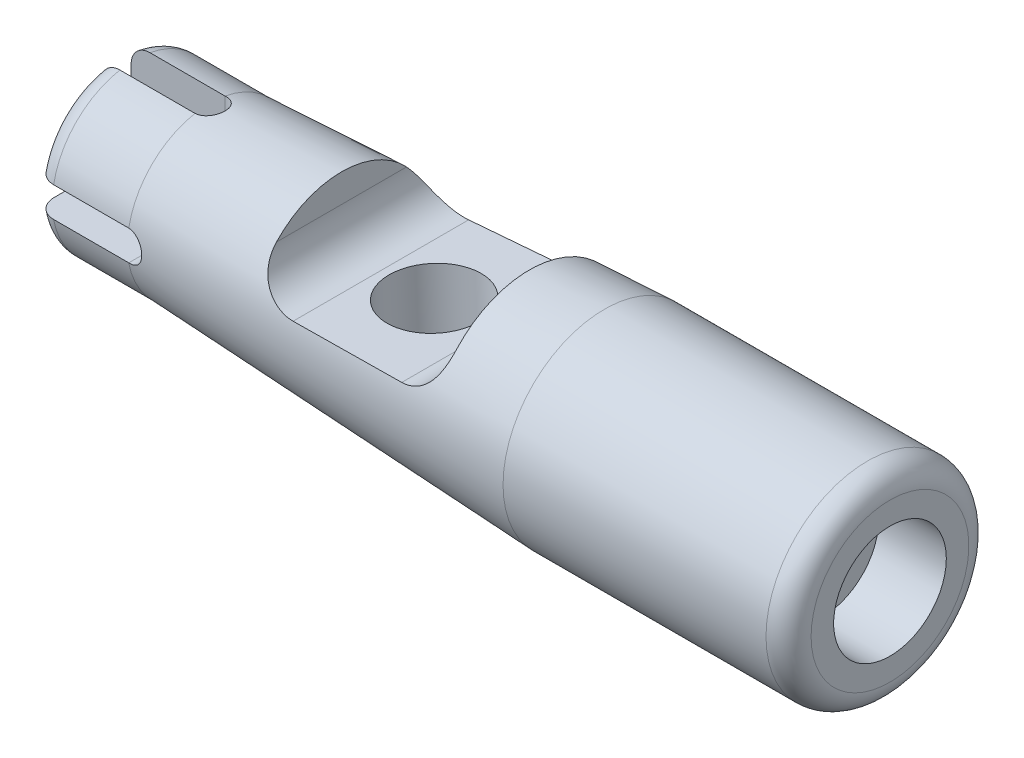
from build123d import *

# Parameters (mm, degrees)
CUT_EXTRUDE1_DEPTH      = 117.039737999
CUT_EXTRUDE2_DEPTH      = 117.039738117
CUT_EXTRUDE2_DEPTH_BACK = 117.039738117
CUT_EXTRUDE3_DEPTH      = 117.039738117
CUT_EXTRUDE3_DEPTH_BACK = 117.039738117
SKETCH4_W               = 57.142016454
SKETCH4_H               = 5
SKETCH5_R               = 3
CUT_EXTRUDE4_DEPTH      = 12
SKETCH6_R               = 15
CUT_EXTRUDE5_DEPTH      = 18
SKETCH6_3_R             = 7.5
CUT_EXTRUDE6_DEPTH      = 38
SKETCH7_R               = 12
CUT_EXTRUDE7_DEPTH      = 16
CIRPATTERN1_COUNT       = 4
FILLET2_R               = 5


with BuildPart() as part:
    # Sketch1 → Revolve1 (revolve)
    with BuildSketch(Plane.XY, mode=Mode.PRIVATE) as revolve1_sk:
        with BuildLine():
            Line((90.422535211, 27), (20.422535211, 27))
            Line((20.422535211, 27), (-84.577464789, 22))
            Line((-84.577464789, 22), (-104.577464789, 22))
            ThreePointArc((-104.577464789, 22), (-108.112998695, 20.535533906), (-109.577464789, 17))
            Line((-109.577464789, 17), (-109.577464789, 0))
            Line((-109.577464789, 0), (96.422535211, 0))
            Line((96.422535211, 0), (96.422535211, 21))
            ThreePointArc((96.422535211, 21), (94.665175898, 25.242640687), (90.422535211, 27))
        make_face()
    revolve(revolve1_sk.sketch.rotate(Axis((-109.577464789, 0, 0), (1, 0, 0)), 90), axis=Axis((-109.577464789, 0, 0), (1, 0, 0)))

    # Sketch2 → Cut-Extrude1 (cut, symmetric)
    with BuildSketch(Plane.XY):
        with BuildLine():
            Line((-123.826972542, 4), (-84.577464789, 4))
            ThreePointArc((-84.577464789, 4), (-80.577464789, 0), (-84.577464789, -4))
            Line((-84.577464789, -4), (-123.826972542, -4))
            ThreePointArc((-123.826972542, -4), (-127.826972542, 0), (-123.826972542, 4))
        make_face()
    cut_extrude1 = extrude(amount=CUT_EXTRUDE1_DEPTH, both=True, mode=Mode.SUBTRACT)

    # Sketch3 → Cut-Extrude2 (cut, two sides: drawn at the far end of the back side and taken through both)
    with BuildSketch(Plane.XY.offset(-CUT_EXTRUDE2_DEPTH_BACK)):
        with BuildLine():
            Line((0.422535211, 26.047619048), (0.422535211, 17.562363413))
            ThreePointArc((0.422535211, 17.562363413), (-2.340182324, 10.661512557), (-9.101813295, 7.573682035))
            Line((-9.101813295, 7.573682035), (-39.101813295, 6.145110607))
            ThreePointArc((-39.101813295, 6.145110607), (-46.478315644, 8.89650952), (-49.577464789, 16.133791984))
            Line((-49.577464789, 16.133791984), (-49.577464789, 23.666666667))
            Line((-49.577464789, 23.666666667), (0.422535211, 26.047619048))
        make_face()
    extrude(amount=CUT_EXTRUDE2_DEPTH + CUT_EXTRUDE2_DEPTH_BACK, mode=Mode.SUBTRACT)

    # Sketch4 → Cut-Extrude3 (cut, two sides: drawn at the far end of the back side and taken through both)
    with BuildSketch(Plane.XY.offset(-CUT_EXTRUDE3_DEPTH_BACK)):
        with Locations((48.993543438, -24.5)):
            Rectangle(SKETCH4_W, SKETCH4_H)
    extrude(amount=CUT_EXTRUDE3_DEPTH + CUT_EXTRUDE3_DEPTH_BACK, mode=Mode.SUBTRACT)

    # Sketch5 → Cut-Extrude4 (cut)
    with BuildSketch(Plane.XZ.offset(22)):
        with Locations(Location((45.127981308, 12, 0), (0, 0, 270))):
            Circle(SKETCH5_R)
        with Locations(Location((45.127981308, -12, 0), (0, 0, 270))):
            Circle(SKETCH5_R)
    extrude(amount=-CUT_EXTRUDE4_DEPTH, mode=Mode.SUBTRACT)

    # Sketch6 → Cut-Extrude5 (cut)
    with BuildSketch(Plane(origin=(96.422535211, 0, 0), x_dir=(0, 0, -1), z_dir=(1, 0, 0))):
        Circle(SKETCH6_R)
    extrude(amount=-CUT_EXTRUDE5_DEPTH, mode=Mode.SUBTRACT)

    # Sketch6<3> → Cut-Extrude6 (cut)
    with BuildSketch(Plane(origin=(96.422535211, 0, 0), x_dir=(0, 0, -1), z_dir=(1, 0, 0))):
        Circle(SKETCH6_3_R)
    extrude(amount=-CUT_EXTRUDE6_DEPTH, mode=Mode.SUBTRACT)

    # Sketch7 → Cut-Extrude7 (cut)
    with BuildSketch(Plane(origin=(-0.38042791, 7.988986101, 0), x_dir=(0.9988681377244376, 0.047565149415449294, 0), z_dir=(-0.0475651494154493, 0.9988681377244377, 0))):
        with Locations(Location((-24.57794304, 0, 0), (0, 0, 180))):
            Circle(SKETCH7_R)
    extrude(amount=-CUT_EXTRUDE7_DEPTH, mode=Mode.SUBTRACT)

    # CirPattern1: Cut-Extrude1 ×4 about axis
    cirpattern1_axis = Axis((-109.577464789, 0, 0), (-1, 0, 0))
    for i in range(1, CIRPATTERN1_COUNT):
        add(cut_extrude1.rotate(cirpattern1_axis, i * 360 / CIRPATTERN1_COUNT), mode=Mode.SUBTRACT)

    # Fillet2
    # the kernel refuses this fillet: 5 mm, written as the material it adds along each edge
    with BuildSketch(Plane(origin=(20.422535211, -22, -28.152475842), x_dir=(1, 0, 0), z_dir=(0, 0, 1))) as fillet2_piece_1_section:
        with BuildLine():
            CenterArc((FILLET2_R, -FILLET2_R), FILLET2_R, 90, 90)
            Line((0, -FILLET2_R), (0, 0))
            Line((0, 0), (FILLET2_R, 0))
        make_face()
    fillet2_piece_1 = extrude(amount=56.304951685, mode=Mode.PRIVATE)
    fillet2_piece_1 = fillet2_piece_1 & Plane(origin=(21.561498993, 0, 0), x_dir=(0, 0, 1), z_dir=(-1, 0, 0)) * Cylinder(27, 133, mode=Mode.PRIVATE)
    add(fillet2_piece_1)
    with BuildSketch(Plane(origin=(77.564551665, -22, 28.152475842), x_dir=(-1, 0, 0), z_dir=(0, 0, -1))) as fillet2_piece_2_section:
        with BuildLine():
            CenterArc((FILLET2_R, -FILLET2_R), FILLET2_R, 90, 90)
            Line((0, -FILLET2_R), (0, 0))
            Line((0, 0), (FILLET2_R, 0))
        make_face()
    fillet2_piece_2 = extrude(amount=56.304951685, mode=Mode.PRIVATE)
    fillet2_piece_2 = fillet2_piece_2 & Plane(origin=(76.380471109, 0, 0), x_dir=(0, 0, 1), z_dir=(-1, 0, 0)) * Cylinder(27, 133, mode=Mode.PRIVATE)
    add(fillet2_piece_2)


solid = part.part
